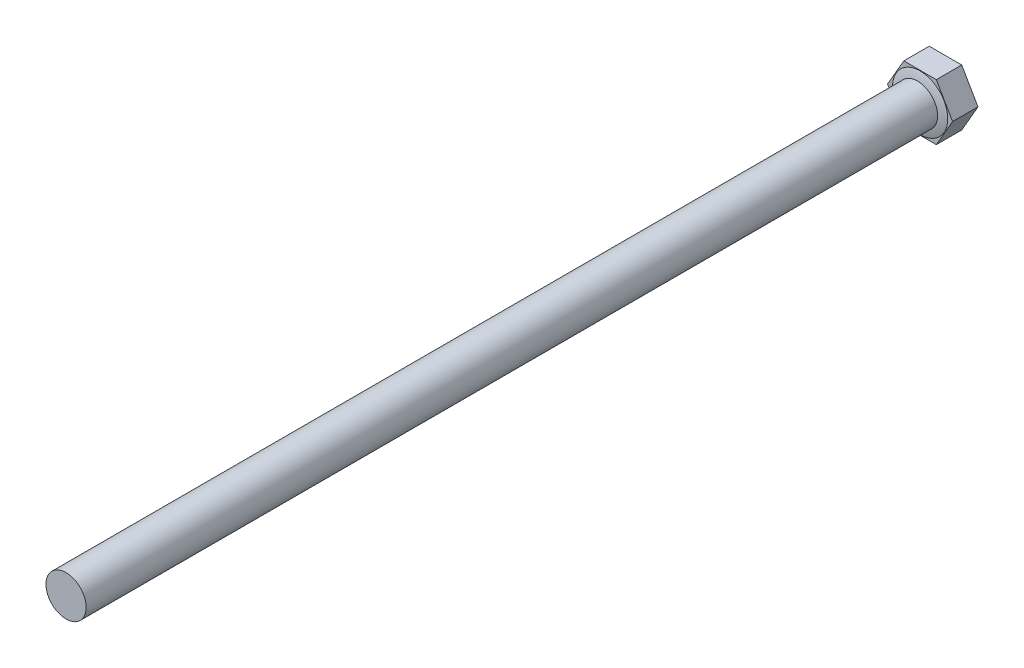
from build123d import *

# Parameters (mm, degrees)
BOSS_EXTRUDE1_DEPTH = 4.9276
SKETCH2_R           = 5.355070432
BOSS_EXTRUDE2_DEPTH = 0.4953
FILLET1_R           = 10.16
SKETCH6_R           = 3.8989
BOSS_EXTRUDE3_DEPTH = 165.1


with BuildPart() as part:
    # Sketch1 → Boss-Extrude1 (new body)
    with BuildSketch(Plane.XY):
        Polygon((6.305518095, 0), (3.152759047, 5.460738854), (-3.152759047, 5.460738854), (-6.305518095, 0), (-3.152759047, -5.460738854), (3.152759047, -5.460738854), align=None)
    extrude(amount=BOSS_EXTRUDE1_DEPTH)

    # Sketch2 → Boss-Extrude2 (add)
    with BuildSketch(Plane.XY.offset(4.9276)):
        Circle(SKETCH2_R)
    extrude(amount=BOSS_EXTRUDE2_DEPTH)

    # Fillet1
    # the kernel refuses this fillet: 10.16 mm, written as the material it takes off along each edge
    with BuildSketch(Plane(origin=(0, 0, 5.4229), x_dir=(1, 0, 0), z_dir=(0, -1, 0))) as fillet1_piece_1:
        with BuildLine():
            CenterArc((2.22151432, -10.16), FILLET1_R, 72.035909036, 17.964090964)
            Line((2.22151432, 0), (2.22151432, 0.2032))
            Line((2.22151432, 0.2032), (5.355070432, 0.2032))
            Line((5.355070432, 0.2032), (5.558270432, 0))
            ThreePointArc((5.558270432, 0), (5.558270432, -0.24765), (5.417741555, -0.302006))
            Line((5.417741555, -0.302006), (5.355070432, -0.4953))
        make_face()
    revolve(axis=Axis((0, 0, 5.4229), (0, 0, 1)), mode=Mode.SUBTRACT)

    # Sketch6 → Boss-Extrude3 (add)
    with BuildSketch(Plane.XY.offset(5.4229)):
        Circle(SKETCH6_R)
    extrude(amount=BOSS_EXTRUDE3_DEPTH)


solid = part.part
